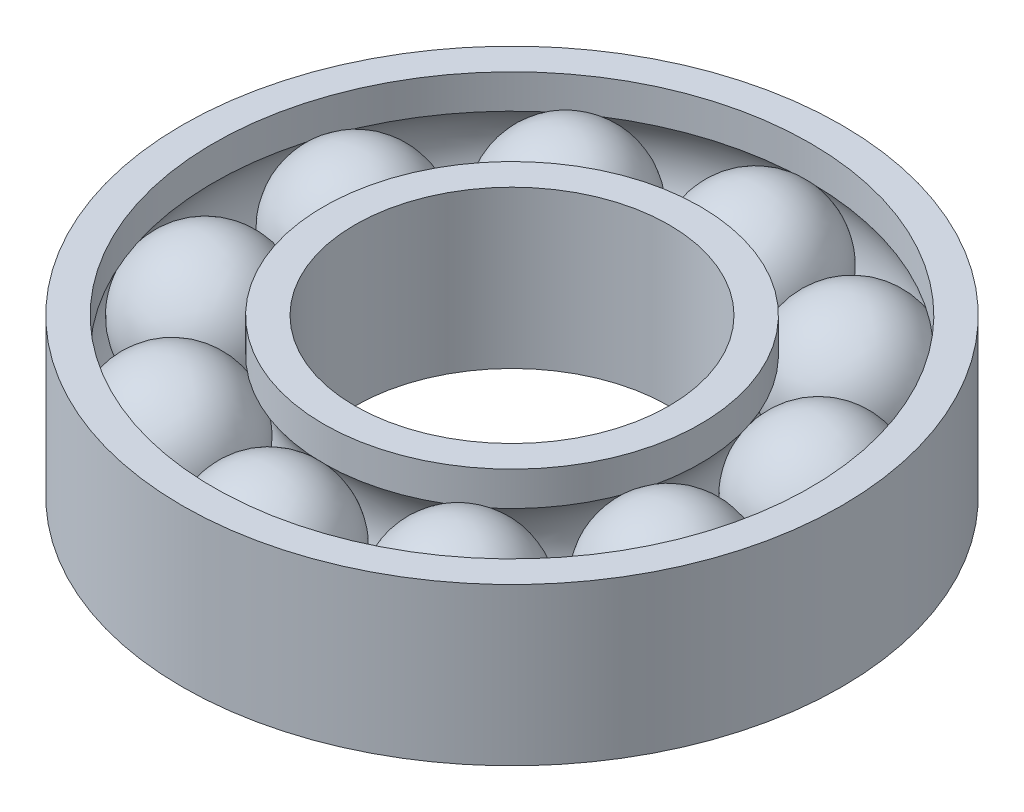
from build123d import *

# Parameters (mm, degrees)
CIRPATTERN2_COUNT = 10


with BuildPart() as part:
    # Sketch2 → Revolve1 (revolve)
    with BuildSketch(Plane(origin=(0, 0, 0), x_dir=(0, 0, -1), z_dir=(1, 0, 0))):
        with BuildLine():
            Line((55, 0), (100, 0))
            ThreePointArc((100, 0), (77.5, 22.5), (55, 0))
        make_face()
    revolve(axis=Axis((0, 0, -55), (0, 0, -1)))


with BuildPart() as body_2:
    # Sketch1 → Revolve2 (revolve)
    with BuildSketch(Plane(origin=(0, 0, 0), x_dir=(0, 0, -1), z_dir=(1, 0, 0))):
        with BuildLine():
            Line((95, 25), (95, 14.142135624))
            ThreePointArc((95, 14.142135624), (100, 0), (95, -14.142135624))
            Line((95, -14.142135624), (95, -25))
            Line((95, -25), (105, -25))
            Line((105, -25), (105, 25))
            Line((105, 25), (95, 25))
        make_face()
        with BuildLine():
            Line((50, 25), (50, -25))
            Line((50, -25), (60, -25))
            Line((60, -25), (60, -14.142135624))
            ThreePointArc((60, -14.142135624), (55, 0), (60, 14.142135624))
            Line((60, 14.142135624), (60, 25))
            Line((60, 25), (50, 25))
        make_face()
    revolve(axis=Axis((0, -25, 0), (0, 1, 0)))


with BuildPart() as cirpattern2_1:
    # CirPattern2: pattern copy
    add(part.part.rotate(Axis((0, -8.25, 0), (0, 1, 0)), 1 * 360 / CIRPATTERN2_COUNT))


with BuildPart() as cirpattern2_2:
    # CirPattern2: pattern copy
    add(part.part.rotate(Axis((0, -8.25, 0), (0, 1, 0)), 2 * 360 / CIRPATTERN2_COUNT))


with BuildPart() as cirpattern2_3:
    # CirPattern2: pattern copy
    add(part.part.rotate(Axis((0, -8.25, 0), (0, 1, 0)), 3 * 360 / CIRPATTERN2_COUNT))


with BuildPart() as cirpattern2_4:
    # CirPattern2: pattern copy
    add(part.part.rotate(Axis((0, -8.25, 0), (0, 1, 0)), 4 * 360 / CIRPATTERN2_COUNT))


with BuildPart() as cirpattern2_5:
    # CirPattern2: pattern copy
    add(part.part.rotate(Axis((0, -8.25, 0), (0, 1, 0)), 5 * 360 / CIRPATTERN2_COUNT))


with BuildPart() as cirpattern2_6:
    # CirPattern2: pattern copy
    add(part.part.rotate(Axis((0, -8.25, 0), (0, 1, 0)), 6 * 360 / CIRPATTERN2_COUNT))


with BuildPart() as cirpattern2_7:
    # CirPattern2: pattern copy
    add(part.part.rotate(Axis((0, -8.25, 0), (0, 1, 0)), 7 * 360 / CIRPATTERN2_COUNT))


with BuildPart() as cirpattern2_8:
    # CirPattern2: pattern copy
    add(part.part.rotate(Axis((0, -8.25, 0), (0, 1, 0)), 8 * 360 / CIRPATTERN2_COUNT))


with BuildPart() as cirpattern2_9:
    # CirPattern2: pattern copy
    add(part.part.rotate(Axis((0, -8.25, 0), (0, 1, 0)), 9 * 360 / CIRPATTERN2_COUNT))


solid = Compound([part.part, body_2.part, cirpattern2_1.part, cirpattern2_2.part, cirpattern2_3.part, cirpattern2_4.part, cirpattern2_5.part, cirpattern2_6.part, cirpattern2_7.part, cirpattern2_8.part, cirpattern2_9.part])
